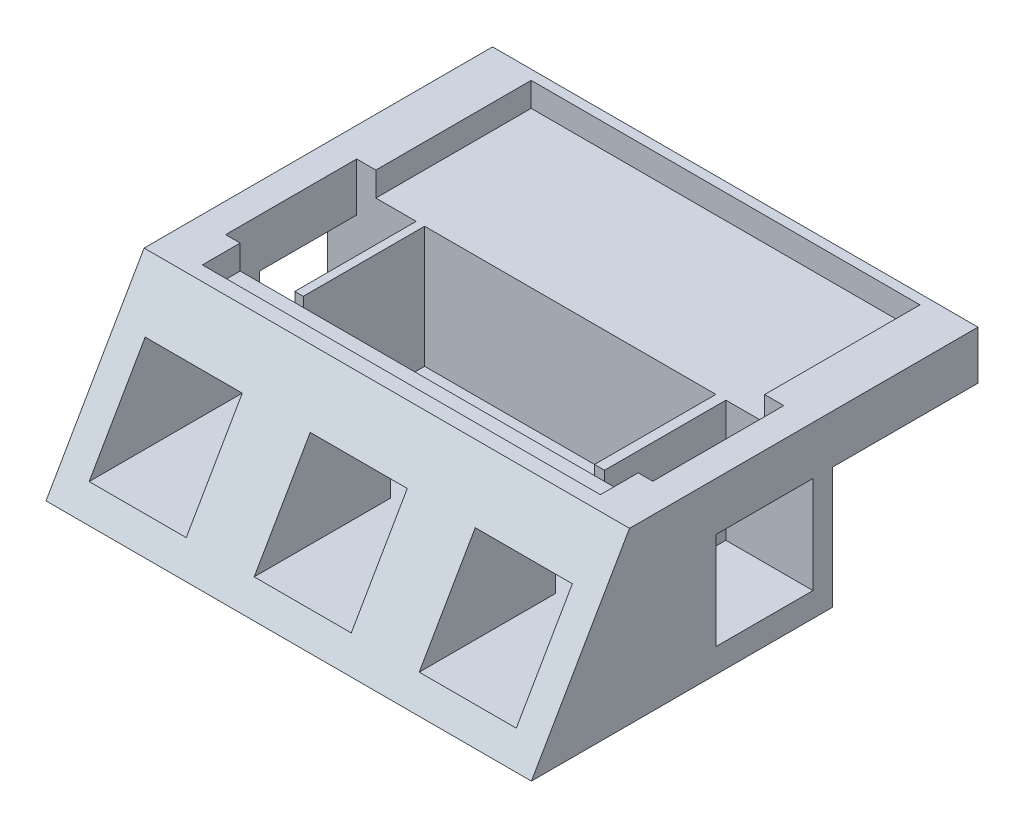
from build123d import *

# Parameters (mm, degrees)
CROQUIS1_W              = 100
CROQUIS1_H              = 62
SALIENTE_EXTRUIR1_DEPTH = 35
CHAFL_N1_SIZE2          = 20.207259422
CHAFL_N1_SIZE           = 35
CROQUIS3_W              = 20
CROQUIS3_H              = 20
CORTAR_EXTRUIR1_DEPTH   = 38
CROQUIS4_W              = 20
CROQUIS4_H              = 20
CORTAR_EXTRUIR2_DEPTH   = 100
CROQUIS7_W              = 88
CROQUIS7_H              = 27
CORTAR_EXTRUIR5_DEPTH   = 30
CORTAR_EXTRUIR6_DEPTH   = 5
CROQUIS9_W              = 1.740341303
CROQUIS9_H              = 25
CROQUIS9_W_2            = 2.064222337
SALIENTE_EXTRUIR2_DEPTH = 25
CROQUIS10_W             = 100
CROQUIS10_H             = 10
SALIENTE_EXTRUIR3_DEPTH = 30
CROQUIS11_W             = 80.1
CROQUIS11_H             = 32
CORTAR_EXTRUIR7_DEPTH   = 5


with BuildPart() as part:
    # Croquis1 → Saliente-Extruir1 (new body)
    with BuildSketch(Plane(origin=(0, 0, 0), x_dir=(1, 0, 0), z_dir=(0, 1, 0))):
        with Locations((50, 31)):
            Rectangle(CROQUIS1_W, CROQUIS1_H)
    extrude(amount=SALIENTE_EXTRUIR1_DEPTH)

    # Chaflán1
    chafl_n1_edges = [part.edges().sort_by_distance(p)[0] for p in [
        (50, 35, 0),
    ]]
    chafl_n1_side = [part.faces().sort_by_distance(p)[0] for p in [
        (50, 34.595854812, 0),
    ]]
    chamfer(chafl_n1_edges, length=CHAFL_N1_SIZE - 0.0001, length2=CHAFL_N1_SIZE2 - 0.0001, reference=chafl_n1_side[0])  # a hair under: the kernel refuses the full size

    # Croquis3 → Cortar-Extruir1 (cut)
    with BuildSketch(Plane.XY):
        with Locations((50, 15)):
            Rectangle(CROQUIS3_W, CROQUIS3_H)
        with Locations((16, 15)):
            Rectangle(CROQUIS3_W, CROQUIS3_H)
        with Locations((84, 15)):
            Rectangle(CROQUIS3_W, CROQUIS3_H)
    extrude(amount=-CORTAR_EXTRUIR1_DEPTH, mode=Mode.SUBTRACT)

    # Croquis4 → Cortar-Extruir2 (cut)
    with BuildSketch(Plane.ZY):
        with Locations((-48, 15)):
            Rectangle(CROQUIS4_W, CROQUIS4_H)
    extrude(amount=-CORTAR_EXTRUIR2_DEPTH, mode=Mode.SUBTRACT)

    # Croquis7 → Cortar-Extruir5 (cut)
    with BuildSketch(Plane(origin=(0, 35, 0), x_dir=(1, 0, 0), z_dir=(0, 1, 0))):
        with Locations((50, 44.5)):
            Rectangle(CROQUIS7_W, CROQUIS7_H)
    extrude(amount=-CORTAR_EXTRUIR5_DEPTH, mode=Mode.SUBTRACT)

    # Croquis8 → Cortar-Extruir6 (cut)
    with BuildSketch(Plane(origin=(0, 35, 0), x_dir=(1, 0, 0), z_dir=(0, 1, 0))):
        Polygon((9, 31), (23, 31), (43, 31), (57, 31), (77, 31), (91, 31), (91, 23.207259422), (77, 23.207259422), (57, 23.207259422), (43, 23.207259422), (23, 23.207259422), (9, 23.207259422), align=None)
    extrude(amount=-CORTAR_EXTRUIR6_DEPTH, mode=Mode.SUBTRACT)

    # Croquis9 → Saliente-Extruir2 (add)
    with BuildSketch(Plane(origin=(0, 5, 0), x_dir=(1, 0, 0), z_dir=(0, 1, 0))):
        with Locations((19.129829349, 45.5)):
            Rectangle(CROQUIS9_W, CROQUIS9_H)
        with Locations((81.032111168, 45.5)):
            Rectangle(CROQUIS9_W_2, CROQUIS9_H)
    extrude(amount=SALIENTE_EXTRUIR2_DEPTH)

    # Croquis10 → Saliente-Extruir3 (add)
    with BuildSketch(Plane(origin=(0, 0, -62), x_dir=(-1, 0, 0), z_dir=(0, 0, -1))):
        with Locations((-50, 30)):
            Rectangle(CROQUIS10_W, CROQUIS10_H)
    extrude(amount=SALIENTE_EXTRUIR3_DEPTH)

    # Croquis11 → Cortar-Extruir7 (cut)
    with BuildSketch(Plane(origin=(0, 35, 0), x_dir=(1, 0, 0), z_dir=(0, 1, 0))):
        with Locations((50, 74)):
            Rectangle(CROQUIS11_W, CROQUIS11_H)
    extrude(amount=-CORTAR_EXTRUIR7_DEPTH, mode=Mode.SUBTRACT)


solid = part.part
